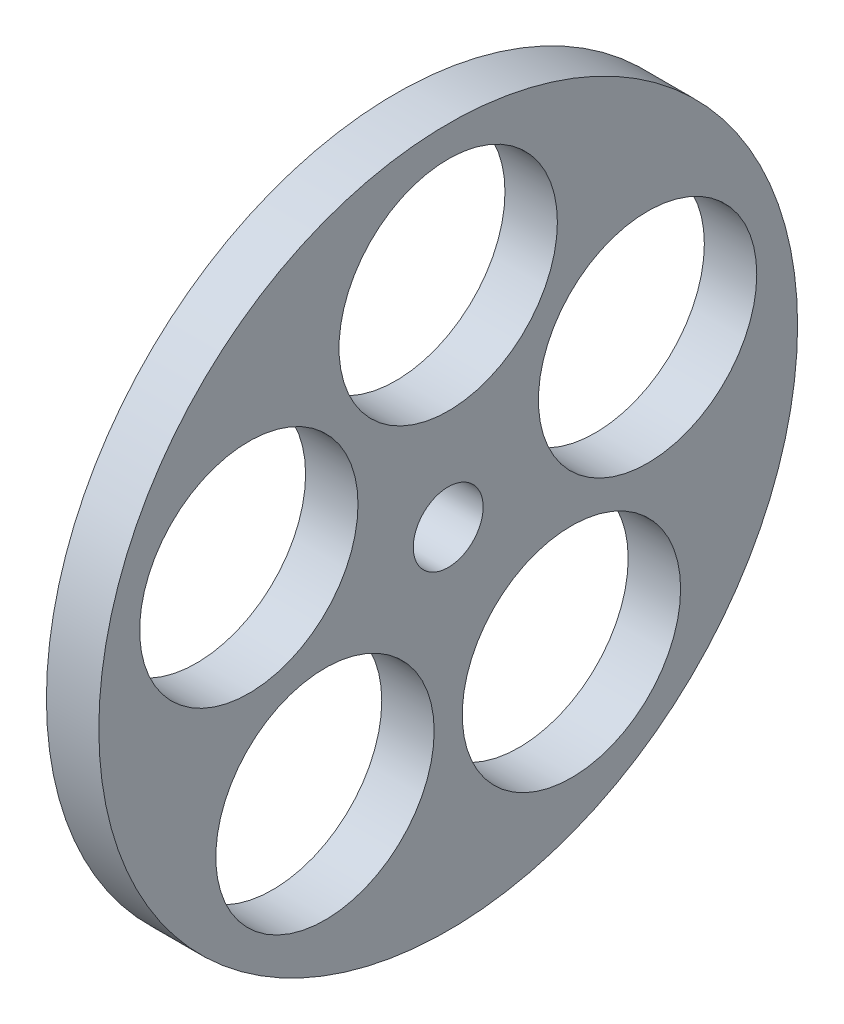
from build123d import *

# Parameters (mm, degrees)
SKETCH1_R           = 40
SKETCH1_R_2         = 4
SKETCH1_R_3         = 12.5
BOSS_EXTRUDE1_DEPTH = 6


with BuildPart() as part:
    # Sketch1 → Boss-Extrude1 (new body)
    with BuildSketch(Plane(origin=(0, 0, 0), x_dir=(0, 0, -1), z_dir=(1, 0, 0))):
        Circle(SKETCH1_R)
        Circle(SKETCH1_R_2, mode=Mode.SUBTRACT)
        with Locations((0, 24)):
            Circle(SKETCH1_R_3, mode=Mode.SUBTRACT)
        with Locations((22.825356391, 7.416407865)):
            Circle(SKETCH1_R_3, mode=Mode.SUBTRACT)
        with Locations((14.106846055, -19.416407865)):
            Circle(SKETCH1_R_3, mode=Mode.SUBTRACT)
        with Locations((-14.106846055, -19.416407865)):
            Circle(SKETCH1_R_3, mode=Mode.SUBTRACT)
        with Locations((-22.825356391, 7.416407865)):
            Circle(SKETCH1_R_3, mode=Mode.SUBTRACT)
    extrude(amount=BOSS_EXTRUDE1_DEPTH)


solid = part.part
